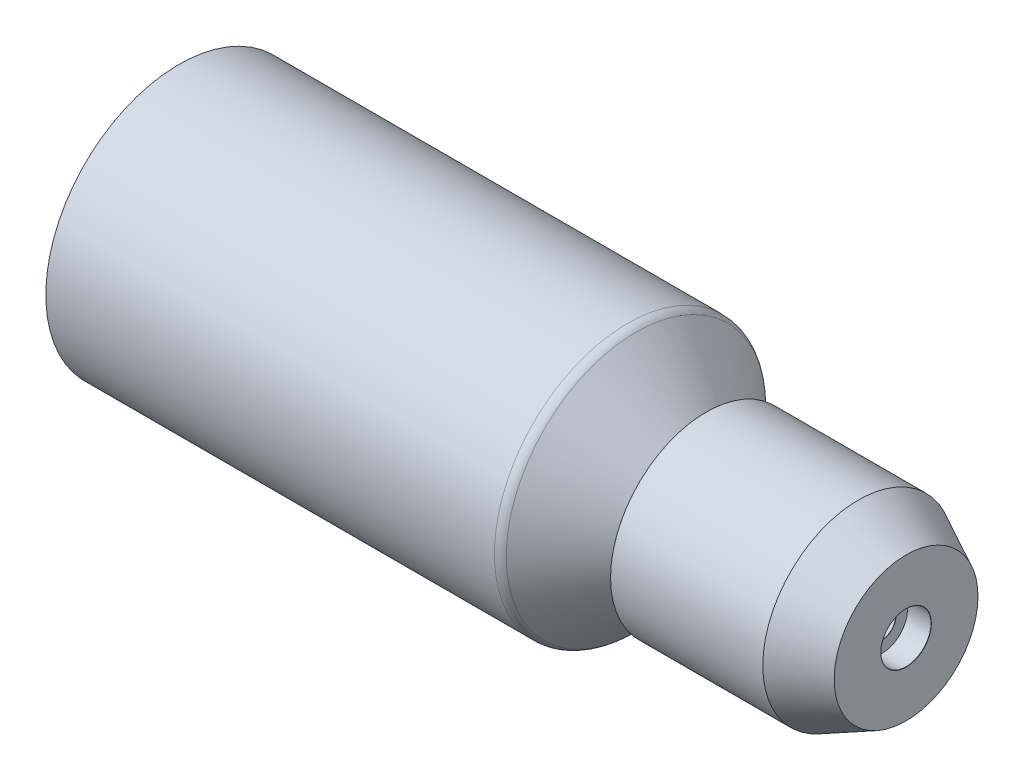
from build123d import *

# Parameters (mm, degrees)
SKETCH10_R          = 12.7762
BOSS_EXTRUDE1_DEPTH = 19.05
CHAMFER1_SIZE       = 6.35
CHAMFER1_SIZE2      = 3.175


with BuildPart() as part:
    # Sketch3 → Revolve1 (revolve)
    with BuildSketch(Plane.XY):
        with BuildLine():
            Line((-76.2, 17.78), (-76.2, 11.43))
            Line((-76.2, 11.43), (-15.663873033, 11.43))
            Line((-15.663873033, 11.43), (-15.663873033, 0))
            Line((-15.663873033, 0), (-5.821373033, 0))
            Line((-5.821373033, 0), (1.798626967, 0))
            Line((1.798626967, 0), (20.848626967, 0))
            Line((20.848626967, 0), (20.848626967, 12.7762))
            Line((20.848626967, 12.7762), (1.798626967, 12.7762))
            Line((1.798626967, 12.7762), (-5.821373033, 12.7762))
            Line((-5.821373033, 12.7762), (-5.821373033, 7.9375))
            Line((-5.821373033, 7.9375), (-15.198905048, 17.315032015))
            ThreePointArc((-15.198905048, 17.315032015), (-15.713927115, 17.659158758), (-16.321437064, 17.78))
            Line((-16.321437064, 17.78), (-76.2, 17.78))
        make_face()
    revolve(axis=Axis((24.172114646, 0, 0), (-1, 0, 0)))

    # Sketch6 → CBORE for M3 SBHCS1 (revolve, cut)
    with BuildSketch(Plane(origin=(-15.663873033, 0, 0), x_dir=(0, 0, 1), z_dir=(0, 1, 0))):
        Polygon((0, 0), (0, 36.5125), (1.8, 36.5125), (1.8, 1.65), (3.35, 1.65), (3.35, 0.025), (3.375, 0), align=None)
    revolve(axis=Axis((-22.013873033, 0, 0), (1, 0, 0)), mode=Mode.SUBTRACT)

    # Sketch10 → Boss-Extrude1 (add)
    with BuildSketch(Plane(origin=(0, 0, 0), x_dir=(0, 0, -1), z_dir=(1, 0, 0))):
        Circle(SKETCH10_R)
    extrude(amount=BOSS_EXTRUDE1_DEPTH)

    # Chamfer1
    chamfer1_edges = [part.edges().sort_by_distance(p)[0] for p in [
        (20.848626967, -12.7762, 0),
    ]]
    chamfer1_side = [part.faces().sort_by_distance(p)[0] for p in [
        (7.513626967, -12.7762, 0),
    ]]
    chamfer(chamfer1_edges, length=CHAMFER1_SIZE, length2=CHAMFER1_SIZE2, reference=chamfer1_side[0])

    # Sketch12 → CBORE for M3 SBHCS3 (revolve, cut)
    with BuildSketch(Plane(origin=(20.848626967, 0, 0), x_dir=(0, 0, -1), z_dir=(0, 1, 0))):
        Polygon((0, 0), (0, 97.048626967), (1.8, 97.048626967), (1.8, 3.2), (1.825, 3.175), (3.35, 3.175), (3.35, 0.025), (3.375, 0), align=None)
    revolve(axis=Axis((27.198626967, 0, 0), (-1, 0, 0)), mode=Mode.SUBTRACT)


with BuildPart() as body_2:
    # split 2: the piece on the far side of the plane
    add(part.part)
    split(bisect_by=Plane(origin=(-5.821373033, 0, 0), x_dir=(0, 0, -1), z_dir=(-1, 0, 0)), keep=Keep.BOTTOM)


with BuildPart() as part_1:
    add(part.part)

    # split 2
    split(bisect_by=Plane(origin=(-5.821373033, 0, 0), x_dir=(0, 0, -1), z_dir=(-1, 0, 0)), keep=Keep.TOP)


solid = Compound([body_2.part, part_1.part])
